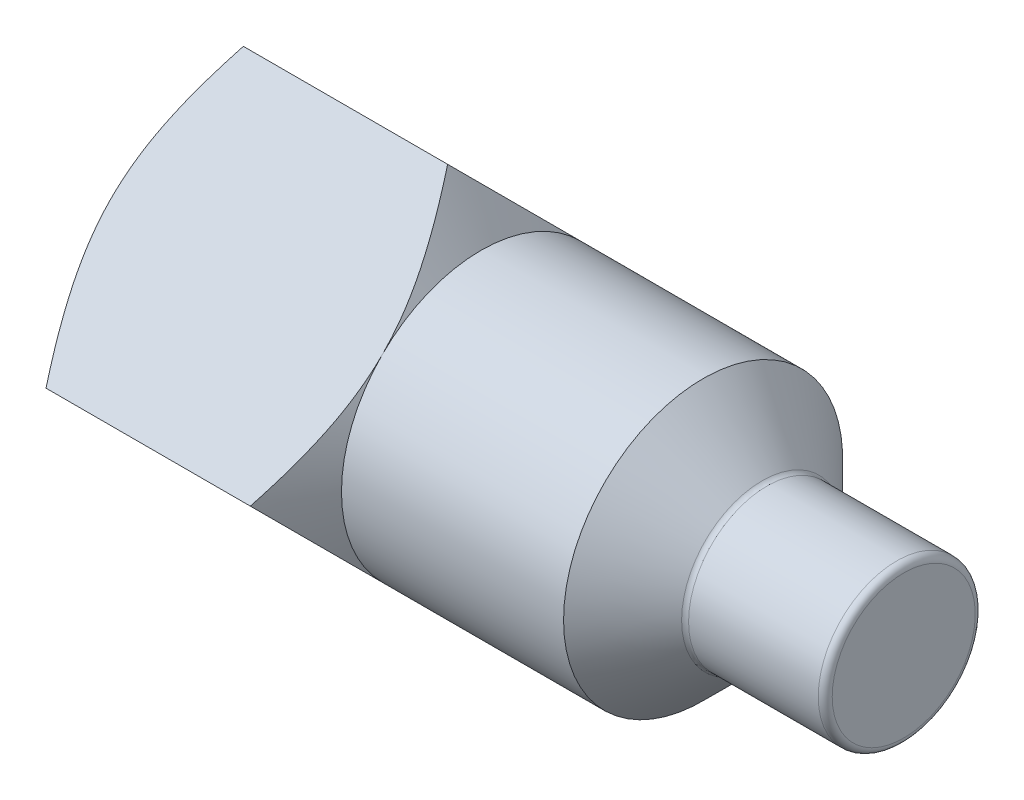
from build123d import *

# Parameters (mm, degrees)
BASEHEAD_DEPTH = 4
FILLET1_R      = 0.1


with BuildPart() as part:
    # BaseHeadSke → BaseHead (new body)
    with BuildSketch(Plane(origin=(0, 0, 0), x_dir=(0, 0, -1), z_dir=(1, 0, 0))):
        Polygon((0, 2.828427125), (2.828427125, 0), (0, -2.828427125), (-2.828427125, 0), align=None)
    extrude(amount=BASEHEAD_DEPTH)

    # HeadChamferSke → HeadChamfer (revolve, cut)
    with BuildSketch(Plane.XY):
        Polygon((0, 2.828427125), (0, 1.9), (0.53602765, 2.828427125), align=None)
        Polygon((3.46397235, 2.828427125), (4, 1.9), (4, 2.828427125), align=None)
    revolve(axis=Axis((0, 0, 0), (1, 0, 0)), mode=Mode.SUBTRACT)

    # BodySke → BaseBody (revolve)
    with BuildSketch(Plane.XY):
        Polygon((3.46397235, 2), (3.46397235, 0), (10, 0), (10, 1.125), (8, 1.125), (8, 2), align=None)
    revolve(axis=Axis((0, 0, 0), (1, 0, 0)))

    # ChamferEndSke → ChamferEnd (revolve, cut)
    with BuildSketch(Plane.XY):
        Polygon((8, 2), (8, 1.125), (7.125, 2), align=None)
    revolve(axis=Axis((0, 0, 0), (1, 0, 0)), mode=Mode.SUBTRACT)

    # Fillet1
    fillet1_edges = [part.edges().sort_by_distance(p)[0] for p in [
        (10, -1.125, 0),
        (8, -1.125, 0),
    ]]
    fillet(fillet1_edges, radius=FILLET1_R)


solid = part.part
